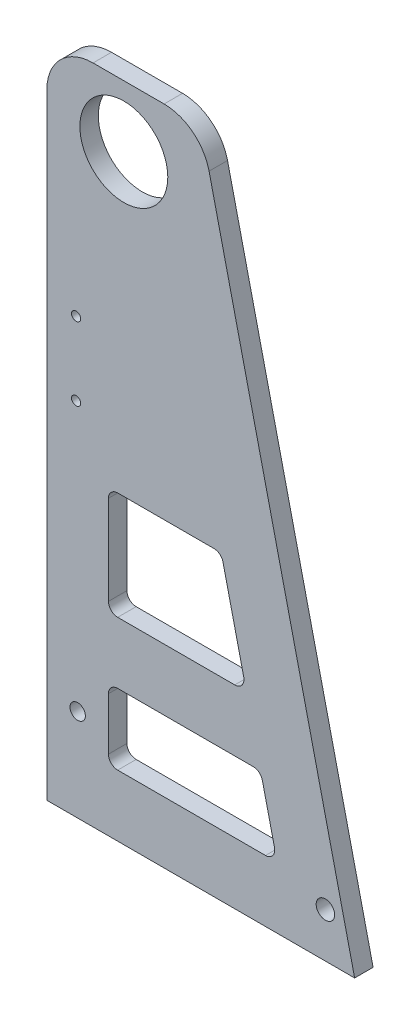
from build123d import *

# Parameters (mm, degrees)
ESBO_O1_R                = 14.2875
ESBO_O1_R_2              = 2.5
RESSALTO_EXTRUS_O2_DEPTH = 6
FILETE1_R                = 15
ESBO_O3_R                = 3
ESBO_O3_RX               = 1.5
ESBO_O3_RY               = 1.426584774
CORTE_EXTRUS_O1_DEPTH    = 238.194013415


with BuildPart() as part:
    # Esboço1 → Ressalto-extrusão2 (new body)
    with BuildSketch(Plane.XY):
        Polygon((0, 0), (0, 215), (50, 215), (100, 0), align=None)
        with Locations((25, 195)):
            Circle(ESBO_O1_R, mode=Mode.SUBTRACT)
        with Locations((10, 30)):
            Circle(ESBO_O1_R_2, mode=Mode.SUBTRACT)
        with BuildLine():
            Line((20, 95), (20, 66))
            ThreePointArc((20, 66), (20.878679656, 63.878679656), (23, 63))
            Line((23, 63), (61.03739436, 63))
            ThreePointArc((61.03739436, 63), (63.386715693, 64.134339454), (63.959418441, 66.679540484))
            Line((63.959418441, 66.679540484), (57.215232395, 95.679540484))
            ThreePointArc((57.215232395, 95.679540484), (56.15886886, 97.349321333), (54.293208314, 98))
            Line((54.293208314, 98), (23, 98))
            ThreePointArc((23, 98), (20.878679656, 97.121320344), (20, 95))
        make_face(mode=Mode.SUBTRACT)
        with BuildLine():
            Line((20, 40), (20, 23))
            ThreePointArc((20, 23), (20.878679656, 20.878679656), (23, 20))
            Line((23, 20), (71.03739436, 20))
            ThreePointArc((71.03739436, 20), (73.386715693, 21.134339454), (73.959418441, 23.679540484))
            Line((73.959418441, 23.679540484), (70.005930069, 40.679540484))
            ThreePointArc((70.005930069, 40.679540484), (68.949566534, 42.349321333), (67.083905988, 43))
            Line((67.083905988, 43), (23, 43))
            ThreePointArc((23, 43), (20.878679656, 42.121320344), (20, 40))
        make_face(mode=Mode.SUBTRACT)
    extrude(amount=RESSALTO_EXTRUS_O2_DEPTH)

    # Filete1
    filete1_edges = [part.edges().sort_by_distance(p)[0] for p in [
        (0, 215, 3),
        (50, 215, 3),
    ]]
    fillet(filete1_edges, radius=FILETE1_R)

    # Esboço3 → Corte-extrusão1 (cut, through all)
    with BuildSketch(Plane(origin=(0, 0, 0), x_dir=(-1, 0, 0), z_dir=(0, 0, -1))):
        with Locations((-90.5, 14.5)):
            Circle(ESBO_O3_R)
        with Locations((-9.5, 117.202456767)):
            Ellipse(ESBO_O3_RX, ESBO_O3_RY)
        with Locations((-9.5, 140.978869674)):
            Ellipse(ESBO_O3_RX, ESBO_O3_RY)
    extrude(amount=-CORTE_EXTRUS_O1_DEPTH, mode=Mode.SUBTRACT)


solid = part.part
